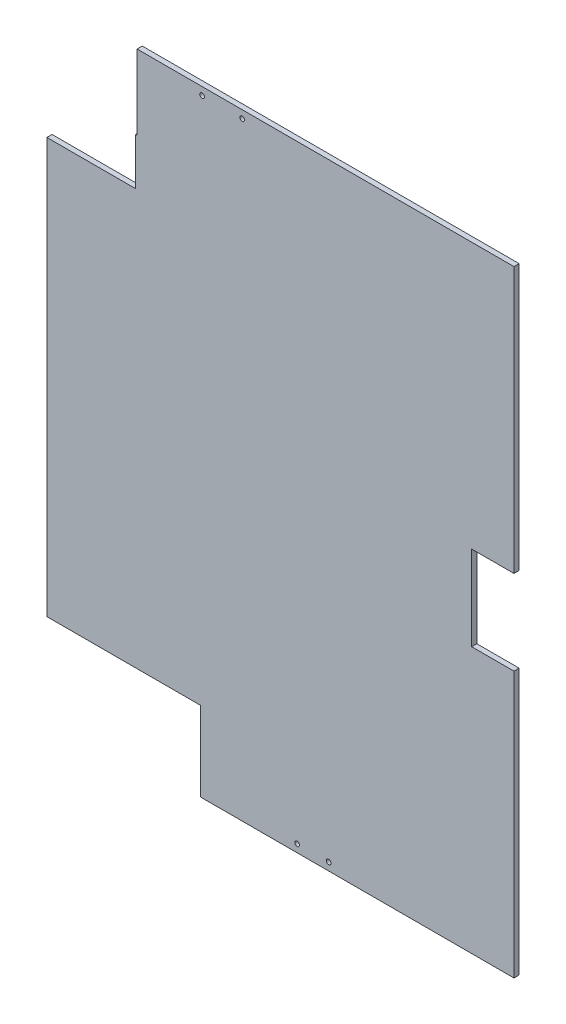
from build123d import *

# Parameters (mm, degrees)
BOSS_EXTRUDE1_DEPTH     = 3.3
SKETCH2_R               = 1.5
CUT_EXTRUDE1_DEPTH      = 453.205952877
CUT_EXTRUDE2_DEPTH      = 455.953272433
CUT_EXTRUDE2_DEPTH_BACK = 455.953272433
SKETCH3_W               = 24.5
SKETCH3_H               = 54
SKETCH4_W               = 26.984189883
SKETCH4_H               = 54
CUT_EXTRUDE3_DEPTH      = 10
SKETCH6_W               = 56.727923661
SKETCH6_H               = 30
CUT_EXTRUDE4_DEPTH      = 10


with BuildPart() as part:
    # Sketch1 → Boss-Extrude1 (new body)
    with BuildSketch(Plane.XY):
        Polygon((25.5, -265), (123.748117859, -265), (123.748117859, -315.7), (323.748117859, -315.7), (323.748117859, 77.7), (83.086263463, 77.7), (83.086263463, 30), (25.5, 30), align=None)
    extrude(amount=BOSS_EXTRUDE1_DEPTH)

    # Sketch2 → Cut-Extrude1 (cut, through all)
    with BuildSketch(Plane(origin=(0, 0, 0), x_dir=(-1, 0, 0), z_dir=(0, 0, -1))):
        with Locations((-150.216261358, 72.7)):
            Circle(SKETCH2_R)
        with Locations((-124.61492379, 72.7)):
            Circle(SKETCH2_R)
        with Locations((-205.394208158, -310.7)):
            Circle(SKETCH2_R)
        with Locations((-185.309760184, -310.7)):
            Circle(SKETCH2_R)
    extrude(amount=-CUT_EXTRUDE1_DEPTH, mode=Mode.SUBTRACT)

    # Sketch3 → Cut-Extrude2 (cut, two sides: drawn at the far end of the back side and taken through both)
    with BuildSketch(Plane(origin=(119.391473557, 0, 256.035841294), x_dir=(0.9063077870366519, 0, -0.42261826174069517), z_dir=(0.42261826174069517, 0, 0.9063077870366519)).offset(-CUT_EXTRUDE2_DEPTH_BACK)):
        with Locations((281.209458836, -119)):
            Rectangle(SKETCH3_W, SKETCH3_H)
    extrude(amount=CUT_EXTRUDE2_DEPTH + CUT_EXTRUDE2_DEPTH_BACK, mode=Mode.SUBTRACT)

    # Sketch4 → Cut-Extrude3 (cut)
    with BuildSketch(Plane(origin=(0, 0, 0), x_dir=(-1, 0, 0), z_dir=(0, 0, -1))):
        with Locations((-310.256022917, -119)):
            Rectangle(SKETCH4_W, SKETCH4_H)
    extrude(amount=-CUT_EXTRUDE3_DEPTH, mode=Mode.SUBTRACT)

    # Sketch6 → Cut-Extrude4 (cut)
    with BuildSketch(Plane.XY.offset(3.3)):
        with Locations((53.863961831, 15)):
            Rectangle(SKETCH6_W, SKETCH6_H)
    extrude(amount=-CUT_EXTRUDE4_DEPTH, mode=Mode.SUBTRACT)


solid = part.part
